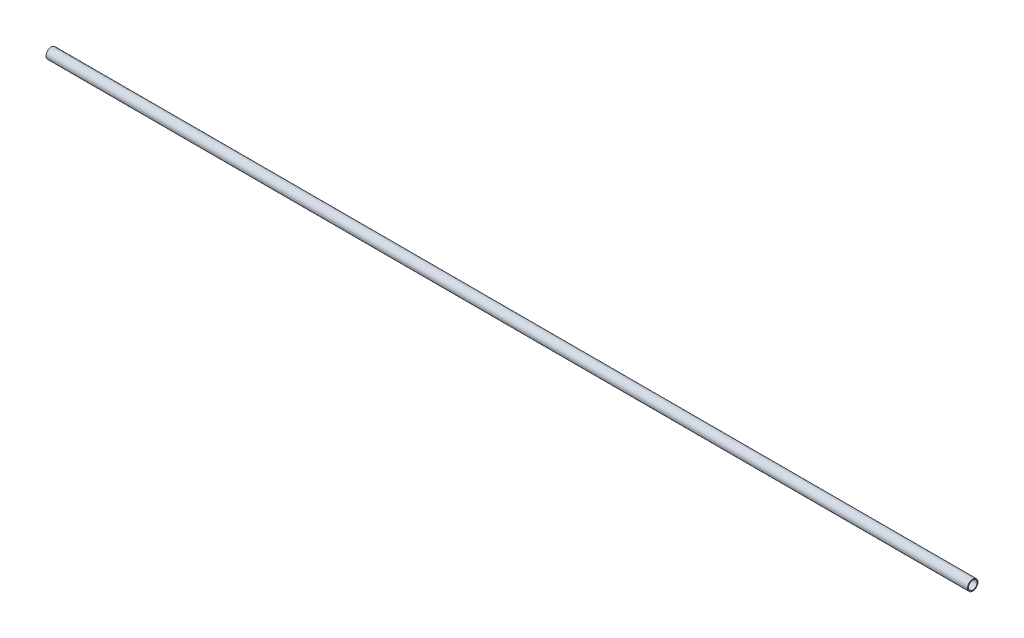
from build123d import *

# Parameters (mm, degrees)
SKETCH1_R           = 0.6223
SKETCH1_R_2         = 0.51435
BOSS_EXTRUDE1_DEPTH = 110


with BuildPart() as part:
    # Sketch1 → Boss-Extrude1 (new body)
    with BuildSketch(Plane(origin=(0, 0, 0), x_dir=(0, 0, -1), z_dir=(1, 0, 0))):
        Circle(SKETCH1_R)
        Circle(SKETCH1_R_2, mode=Mode.SUBTRACT)
    extrude(amount=BOSS_EXTRUDE1_DEPTH)


solid = part.part
